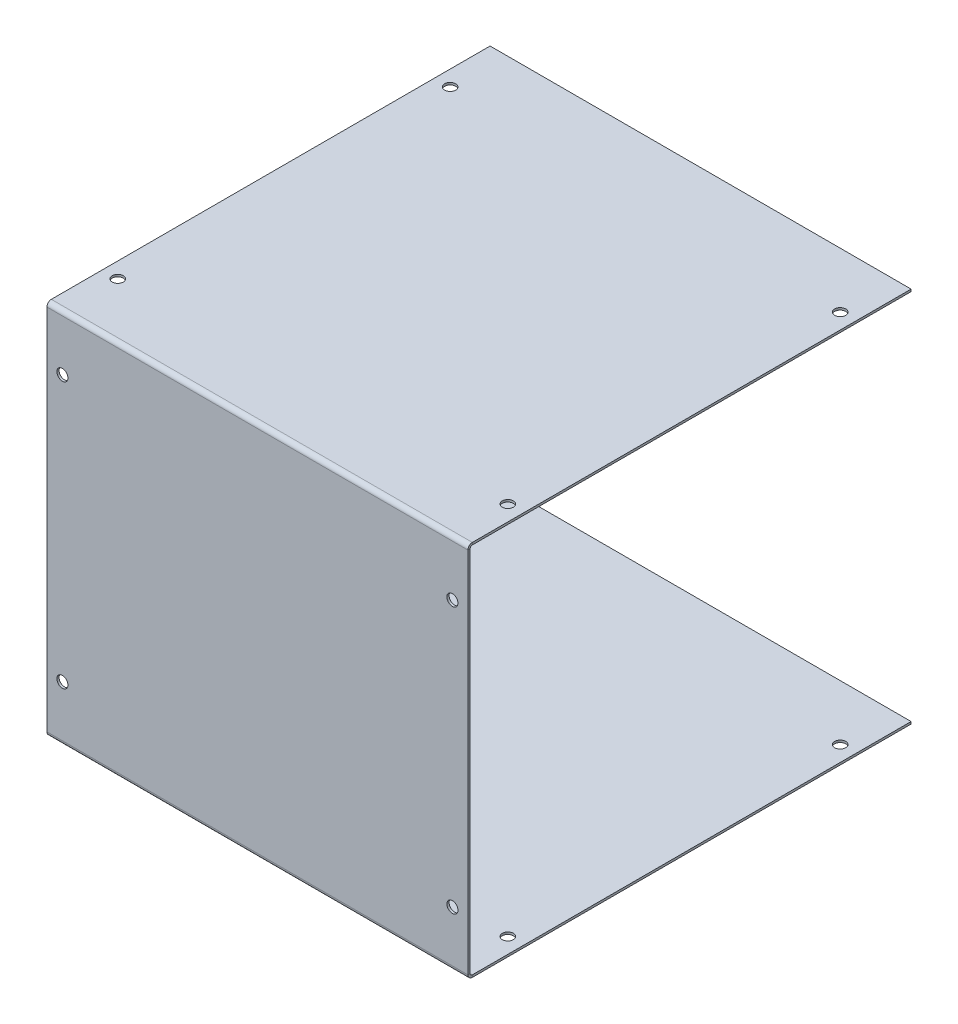
from build123d import *

# Parameters (mm, degrees)
SKETCH1_W                      = 190
SKETCH1_H                      = 170
BASE_FLANGE1_DEPTH             = 1
SKETCH23_R                     = 2.5
CUT_EXTRUDE1_DEPTH             = 10
EDGE_FLANGE5_STRIP_W           = 6
EDGE_FLANGE5_STRIP_H           = 1
EDGE_FLANGE5_STRIP_CUT_DEPTH   = 190
EDGE_FLANGE5_STRIP_2_W         = 6
EDGE_FLANGE5_STRIP_2_H         = 1
EDGE_FLANGE5_STRIP_CUT_2_DEPTH = 190
EDGE_FLANGE5_DEPTH             = 190
EDGE_FLANGE5_BEND_DEPTH        = 190
SKETCH44_R                     = 2.5
CUT_EXTRUDE2_DEPTH             = 180


# Sheet-metal steps are written as plain solids
with BuildPart() as part:
    # Sketch1 → Base-Flange1 (new body)
    with BuildSketch(Plane.XY):
        Rectangle(SKETCH1_W, SKETCH1_H)
    extrude(amount=-BASE_FLANGE1_DEPTH)

    # Sketch23 → Cut-Extrude1 (cut)
    with BuildSketch(Plane.XY):
        with Locations((-88, 60)):
            Circle(SKETCH23_R)
        with Locations((88, 60)):
            Circle(SKETCH23_R)
        with Locations((88, -60)):
            Circle(SKETCH23_R)
        with Locations((-88, -60)):
            Circle(SKETCH23_R)
    extrude(amount=-CUT_EXTRUDE1_DEPTH, mode=Mode.SUBTRACT)

    # Edge-Flange5 strip (across the edge) → Edge-Flange5 strip cut (cut)
    with BuildSketch(Plane(origin=(-95, 85, -1), x_dir=(0, -1, 0), z_dir=(1, 0, 0))):
        with Locations((-1, -0.5)):
            Rectangle(EDGE_FLANGE5_STRIP_W, EDGE_FLANGE5_STRIP_H)
    extrude(amount=EDGE_FLANGE5_STRIP_CUT_DEPTH, mode=Mode.SUBTRACT)

    # Edge-Flange5 strip 2 (across the edge) → Edge-Flange5 strip cut 2 (cut)
    with BuildSketch(Plane(origin=(95, -85, -1), x_dir=(0, 1, 0), z_dir=(-1, 0, 0))):
        with Locations((-1, -0.5)):
            Rectangle(EDGE_FLANGE5_STRIP_2_W, EDGE_FLANGE5_STRIP_2_H)
    extrude(amount=EDGE_FLANGE5_STRIP_CUT_2_DEPTH, mode=Mode.SUBTRACT)

    # Edge-Flange5 section (across the edge) → Edge-Flange5 (add)
    with BuildSketch(Plane(origin=(-95, 85, -1), x_dir=(0, -1, 0), z_dir=(1, 0, 0))):
        with BuildLine():
            Line((0, 1), (0, 199))
            Line((0, 199), (1, 199))
            Line((1, 199), (1, 1))
            ThreePointArc((1, 1), (1.292893219, 0.292893219), (2, 0))
            Line((2, 0), (2, -1))
            ThreePointArc((2, -1), (0.585786438, -0.414213562), (0, 1))
        make_face()
    extrude(amount=EDGE_FLANGE5_DEPTH)

    # Edge-Flange5 section 2 (across the edge) → Edge-Flange5 bend (add)
    with BuildSketch(Plane(origin=(95, -85, -1), x_dir=(0, 1, 0), z_dir=(-1, 0, 0))):
        with BuildLine():
            Line((0, 1), (0, 199))
            Line((0, 199), (1, 199))
            Line((1, 199), (1, 1))
            ThreePointArc((1, 1), (1.292893219, 0.292893219), (2, 0))
            Line((2, 0), (2, -1))
            ThreePointArc((2, -1), (0.585786438, -0.414213562), (0, 1))
        make_face()
    extrude(amount=EDGE_FLANGE5_BEND_DEPTH)

    # Sketch44 → Cut-Extrude2 (cut)
    with BuildSketch(Plane(origin=(0, 85, 0), x_dir=(1, 0, 0), z_dir=(0, 1, 0))):
        with Locations(Location((-88, 175, 0), (0, 0, 270))):
            Circle(SKETCH44_R)
        with Locations(Location((88, 175, 0), (0, 0, 270))):
            Circle(SKETCH44_R)
        with Locations(Location((88, 25, 0), (0, 0, 270))):
            Circle(SKETCH44_R)
        with Locations(Location((-88, 25, 0), (0, 0, 270))):
            Circle(SKETCH44_R)
    extrude(amount=-CUT_EXTRUDE2_DEPTH, mode=Mode.SUBTRACT)


solid = part.part
